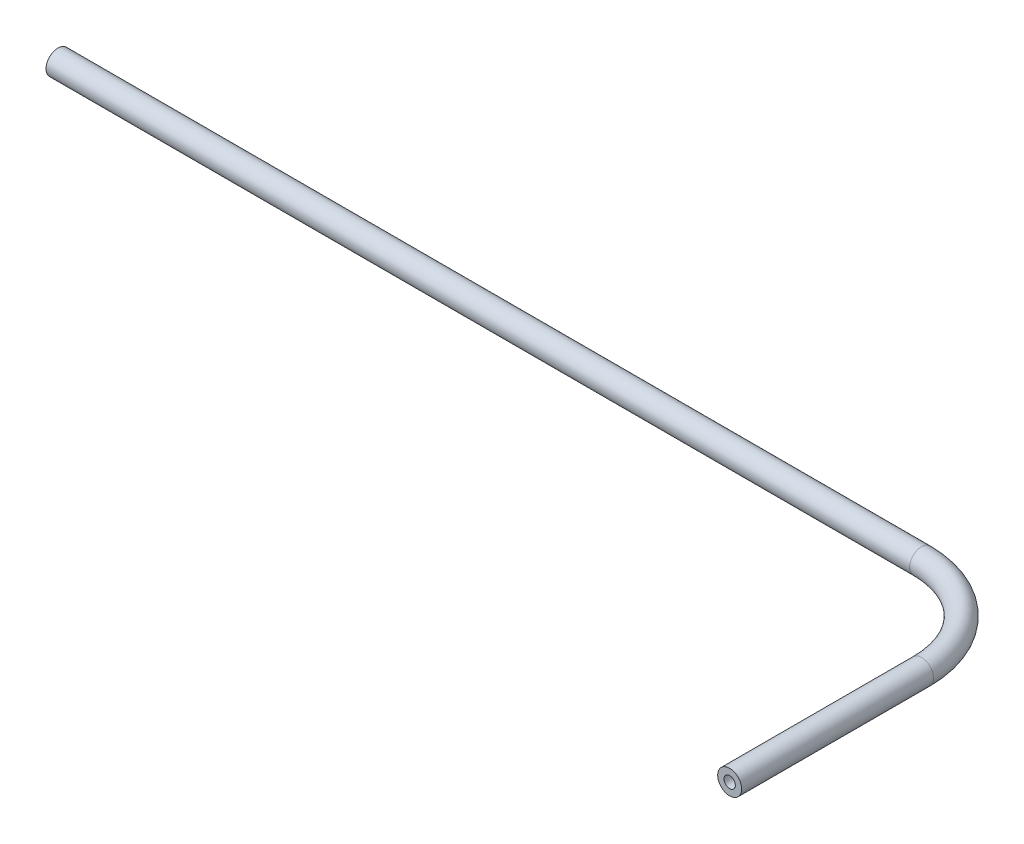
from build123d import *

# Parameters (mm, degrees)
SKETCH2_R   = 3.175
SKETCH2_R_2 = 1.5


with BuildPart() as part:
    # Sweep1: sweep along a path in Sketch1
    with BuildLine(Plane(origin=(0, 0, 0), x_dir=(1, 0, 0), z_dir=(0, 1, 0))) as sweep1_path:
        Line((-254, 0), (-25.4, 0))
        ThreePointArc((-25.4, 0), (-7.439487758, -7.439487758), (0, -25.4))
        Line((0, -25.4), (0, -76.2))
    # Sketch2 → Sweep1 (sweep)
    with BuildSketch(Plane(origin=(-254, 0, 0), x_dir=(0, 0, -1), z_dir=(1, 0, 0))):
        Circle(SKETCH2_R)
        Circle(SKETCH2_R_2, mode=Mode.SUBTRACT)
    sweep(path=sweep1_path.line)


solid = part.part
